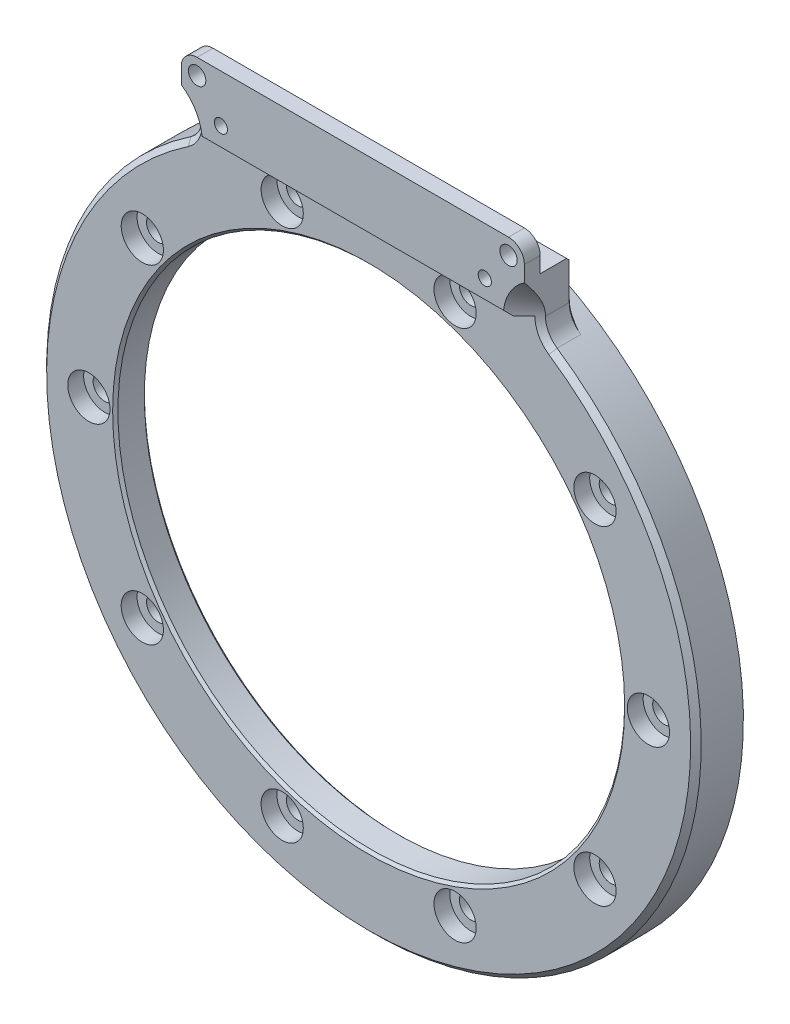
from build123d import *

# Parameters (mm, degrees)
SKETCH_1_R             = 62
SKETCH_1_R_2           = 60
EXTRUDE_1_DEPTH        = 3
EXTRUDE_START          = 6
SKETCH_2_R             = 48
EXTRUDE_2_DEPTH        = 6
FILLET_1_R             = 5
CHAMFER_1_SIZE         = 0.5
CHAMFER_2_SIZE         = 0.5
SKETCH_6_R             = 2.2
CUT_EXTRUDE_1_DEPTH    = 6
SKETCH_7_W             = 65
SKETCH_7_H             = 13.477482046
EXTRUDE_3_DEPTH        = 3
SKETCH_11_R            = 1.65
CUT_EXTRUDE_2_DEPTH    = 3
CHAMFER_3_SIZE         = 1
CHAMFER_4_SIZE         = 1
FILLET_2_R             = 3
CHAMFER_5_3_ANGLE      = 291.929687
SKETCH_12_R            = 4
CUT_EXTRUDE_3_DEPTH    = 3
CUT_EXTRUDE_4_DEPTH    = 2
CHAMFER_6_SIZE         = 1
HOLE_WIZARD_M3_1_D     = 2.5
HOLE_WIZARD_M3_1_DEPTH = 7.5
HOLE_WIZARD_M3_1_TIP   = 0.751075774


with BuildPart() as part:
    # 草图1 → 凸台-拉伸1 (new body)
    with BuildSketch(Plane.XY):
        Circle(SKETCH_1_R)
        Circle(SKETCH_1_R_2, mode=Mode.SUBTRACT)
    extrude(amount=-EXTRUDE_1_DEPTH)

    # 草图2 → 凸台-拉伸2 (add)
    with BuildSketch(Plane.XY.offset(EXTRUDE_START)):
        with BuildLine():
            Line((-32.5, 63), (32.5, 63))
            Line((32.5, 63), (32.5, 52.79914772))
            ThreePointArc((32.5, 52.79914772), (0, -62), (-32.5, 52.79914772))
            Line((-32.5, 52.79914772), (-32.5, 63))
        make_face()
        Circle(SKETCH_2_R, mode=Mode.SUBTRACT)
    extrude(amount=-EXTRUDE_2_DEPTH)

    # 圆角1
    # the kernel refuses this fillet: 5 mm, written as the material it adds along each edge
    with BuildSketch(Plane(origin=(32.5, 52.79914772, 6), x_dir=(0.8403342947446245, -0.5420685132675156, 0), z_dir=(0, 0, -1))) as fillet_1_piece_1:
        with BuildLine():
            CenterArc((2.72541822, -4.998883971), FILLET_1_R, 91.210593649, 55.964843523)
            Line((-1.476253254, -2.288541405), (0, 0))
            ThreePointArc((0, 0), (1.309890927, -0.013838756), (2.619781855, 0))
        make_face()
    extrude(amount=6)
    with BuildSketch(Plane(origin=(-32.5, 52.79914772, 6), x_dir=(-0.840334294744627, -0.5420685132675117, 0), z_dir=(0, 0, -1))) as fillet_1_piece_2:
        with BuildLine():
            CenterArc((2.72541822, 4.998883971), FILLET_1_R, 212.824562828, 55.964843523)
            Line((-1.476253254, 2.288541405), (0, 0))
            ThreePointArc((0, 0), (1.309890927, 0.013838756), (2.619781855, 0))
        make_face()
    extrude(amount=6)

    # 倒角1
    chamfer_1_edges = [part.edges().sort_by_distance(p)[0] for p in [
        (-48, 0, 0),
        (-48, 0, 6),
        (-60, 0, -3),
    ]]
    chamfer(chamfer_1_edges, length=CHAMFER_1_SIZE)

    # 倒角2
    # the kernel refuses this chamfer: 0.5 mm, written as the material it takes off along each edge
    with BuildSketch(Plane(origin=(-32.5, 55.522517954, 0), x_dir=(0, 0, 1), z_dir=(0, 1, 0)), Plane(origin=(32.5, 64.285841494, 0), x_dir=(0, 0, 1), z_dir=(0, -1, 0))) as chamfer_2_piece_1:
        Polygon((CHAMFER_2_SIZE, 0), (0, CHAMFER_2_SIZE), (0, 0), align=None)
    extrude(amount=8.76332354, mode=Mode.SUBTRACT)
    with BuildSketch(Plane(origin=(37.5, 55.522517954, 0), x_dir=(-0.15613015555825177, -0.9877364904291813, 0), z_dir=(0.9877364904291813, -0.15613015555825177, 0))) as chamfer_2_piece_2_section:
        Polygon((5, -CHAMFER_2_SIZE), (5 + CHAMFER_2_SIZE, 0), (5, 0), align=None)
    chamfer_2_piece_2 = revolve(axis=Axis((37.5, 55.522517954, 0), (0, 0, -1)), revolution_arc=81.017652556, mode=Mode.PRIVATE)
    chamfer_2_piece_2 = chamfer_2_piece_2 - Plane(origin=(0, 0, 0), x_dir=(1, 0, 0), z_dir=(0, 0, 1)) * Cylinder(62, 22, mode=Mode.PRIVATE)
    add(chamfer_2_piece_2, mode=Mode.SUBTRACT)
    with BuildSketch(Plane(origin=(-37.5, 55.522517954, 0), x_dir=(1, 0, 0), z_dir=(0, 1, 0))) as chamfer_2_piece_3_section:
        Polygon((5, -CHAMFER_2_SIZE), (5 + CHAMFER_2_SIZE, 0), (5, 0), align=None)
    chamfer_2_piece_3 = revolve(axis=Axis((-37.5, 55.522517954, 0), (0, 0, -1)), revolution_arc=81.017652556, mode=Mode.PRIVATE)
    chamfer_2_piece_3 = chamfer_2_piece_3 - Plane(origin=(0, 0, 0), x_dir=(1, 0, 0), z_dir=(0, 0, 1)) * Cylinder(62, 22, mode=Mode.PRIVATE)
    add(chamfer_2_piece_3, mode=Mode.SUBTRACT)

    # 草图6 → 切除-拉伸1 (cut)
    with BuildSketch(Plane(origin=(0, 0, 0), x_dir=(-1, 0, 0), z_dir=(0, 0, -1))):
        with Locations((-42.877900702, 31.152618372)):
            Circle(SKETCH_6_R)
        with Locations((-53, 0)):
            Circle(SKETCH_6_R)
        with Locations((-42.877900702, -31.152618371)):
            Circle(SKETCH_6_R)
        with Locations((-16.377900702, -50.405995364)):
            Circle(SKETCH_6_R)
        with Locations((16.377900702, -50.405995364)):
            Circle(SKETCH_6_R)
        with Locations((42.877900702, -31.152618371)):
            Circle(SKETCH_6_R)
        with Locations((53, 0)):
            Circle(SKETCH_6_R)
        with Locations((42.877900702, 31.152618372)):
            Circle(SKETCH_6_R)
        with Locations((16.377900702, 50.405995364)):
            Circle(SKETCH_6_R)
        with Locations((-16.377900702, 50.405995364)):
            Circle(SKETCH_6_R)
    extrude(amount=-CUT_EXTRUDE_1_DEPTH, mode=Mode.SUBTRACT)

    # 草图7 → 凸台-拉伸3 (add)
    with BuildSketch(Plane.XY.offset(6)):
        with Locations((0, 62.261258977)):
            Rectangle(SKETCH_7_W, SKETCH_7_H)
    extrude(amount=EXTRUDE_3_DEPTH)

    # 草图11 → 切除-拉伸2 (cut)
    with BuildSketch(Plane.XY.offset(9)):
        with Locations((-29.5, 66)):
            Circle(SKETCH_11_R)
        with Locations((29.5, 66)):
            Circle(SKETCH_11_R)
    extrude(amount=-CUT_EXTRUDE_2_DEPTH, mode=Mode.SUBTRACT)

    # 倒角3
    chamfer_3_edges = [part.edges().sort_by_distance(p)[0] for p in [
        (0, 63, 0),
    ]]
    chamfer(chamfer_3_edges, length=CHAMFER_3_SIZE - 0.0001)  # a hair under: the kernel refuses the full size

    # 倒角4
    chamfer_4_edges = [part.edges().sort_by_distance(p)[0] for p in [
        (0, 55.522517954, 9),
    ]]
    chamfer(chamfer_4_edges, length=CHAMFER_4_SIZE)

    # 圆角2
    fillet_2_edges = [part.edges().sort_by_distance(p)[0] for p in [
        (-32.5, 69, 7.5),
        (32.5, 69, 7.5),
    ]]
    fillet(fillet_2_edges, radius=FILLET_2_R)

    # 倒角5: read off the stored shape, not the designer's step
    # 倒角5 outline → 倒角5 (revolve, cut)
    with BuildSketch(Plane(origin=(37.5, 55.522517954, 0), x_dir=(1, 0, 0), z_dir=(0, -1, 0))):
        Polygon((4.999998721, 9), (4.999998721, 4.999998721), (9, 9), align=None)
    revolve(axis=Axis((37.5, 55.522517954, 0), (0, 0, 1)), mode=Mode.SUBTRACT)

    # Chamfer 5 2 outline → Chamfer 5 2 (revolve, cut)
    with BuildSketch(Plane(origin=(-37.5, 55.522517954, 0), x_dir=(1, 0, 0), z_dir=(0, -1, 0))):
        Polygon((4.99999762, 9), (4.99999762, 4.99999762), (9, 9), align=None)
    revolve(axis=Axis((-37.5, 55.522517954, 0), (0, 0, 1)), mode=Mode.SUBTRACT)

    # Chamfer 5 3 outline → Chamfer 5 3 (revolve, cut)
    with BuildSketch(Plane(origin=(0, 0, 0), x_dir=(-0.5597014925373135, 0.8286942978273132, 0), z_dir=(0.8286942978273132, 0.5597014925373135, 0))):
        Polygon((62, 6), (61, 6), (62, 5), align=None)
    revolve(axis=Axis((0, 0, 0), (0, 0, 1)), revolution_arc=CHAMFER_5_3_ANGLE, mode=Mode.SUBTRACT)

    # 草图12 → 切除-拉伸3 (cut)
    with BuildSketch(Plane.XY.offset(6)):
        with Locations((-16.377900702, 50.405995364)):
            Circle(SKETCH_12_R)
        with Locations((16.377900702, 50.405995364)):
            Circle(SKETCH_12_R)
        with Locations((42.877900702, 31.152618372)):
            Circle(SKETCH_12_R)
        with Locations((53, 0)):
            Circle(SKETCH_12_R)
        with Locations((42.877900702, -31.152618371)):
            Circle(SKETCH_12_R)
        with Locations((16.377900702, -50.405995364)):
            Circle(SKETCH_12_R)
        with Locations((-16.377900702, -50.405995364)):
            Circle(SKETCH_12_R)
        with Locations((-42.877900702, -31.152618371)):
            Circle(SKETCH_12_R)
        with Locations((-53, 0)):
            Circle(SKETCH_12_R)
        with Locations((-42.877900702, 31.152618372)):
            Circle(SKETCH_12_R)
    extrude(amount=-CUT_EXTRUDE_3_DEPTH, mode=Mode.SUBTRACT)

    # 草图14 → 切除-拉伸4 (cut)
    with BuildSketch(Plane(origin=(0, 63, 0), x_dir=(1, 0, 0), z_dir=(0, 1, 0))):
        with BuildLine():
            ThreePointArc((-4.030108666, 3.809429698), (-11.733833556, 7.447967709), (-11.5, -1.068584287))
            ThreePointArc((-11.5, -1.068584287), (0, -4.15), (11.5, -1.068584287))
            ThreePointArc((11.5, -1.068584287), (11.733833556, 7.447967709), (4.030108666, 3.809429698))
            ThreePointArc((4.030108666, 3.809429698), (0, 5.85), (-4.030108666, 3.809429698))
        make_face()
    extrude(amount=-CUT_EXTRUDE_4_DEPTH, mode=Mode.SUBTRACT)

    # 倒角6
    # the kernel refuses this chamfer: 1 mm, written as the material it takes off along each edge
    with BuildSketch(Plane(origin=(18.80558547, 61, -3), x_dir=(0, -1, 0), z_dir=(-1, 0, 0))) as chamfer_6_piece_1:
        Polygon((CHAMFER_6_SIZE, 0), (0, CHAMFER_6_SIZE), (0, 0), align=None)
    extrude(amount=37.61117094, mode=Mode.SUBTRACT)
    with BuildSketch(Plane(origin=(-9, 63, -3.261542732), x_dir=(-0.874686173337968, 0, 0.48468969266055384), z_dir=(-0.48468969266055384, 0, -0.874686173337968))) as chamfer_6_piece_2:
        Polygon((5, -CHAMFER_6_SIZE), (5 + CHAMFER_6_SIZE, 0), (5, 0), align=None)
    revolve(axis=Axis((-9, 63, -3.261542732), (0, 1, 0)), revolution_arc=31.007856081, mode=Mode.SUBTRACT)
    with BuildSketch(Plane(origin=(9, 63, -3.261542732), x_dir=(0.49999999999998873, 0, 0.8660254037844451), z_dir=(-0.8660254037844451, 0, 0.49999999999998873))) as chamfer_6_piece_3:
        Polygon((5, -CHAMFER_6_SIZE), (5 + CHAMFER_6_SIZE, 0), (5, 0), align=None)
    revolve(axis=Axis((9, 63, -3.261542732), (0, 1, 0)), revolution_arc=31.007856081, mode=Mode.SUBTRACT)
    with BuildSketch(Plane(origin=(0, 63, -18.85), x_dir=(-0.500000000000001, 0, 0.8660254037844382), z_dir=(-0.8660254037844382, 0, -0.500000000000001))) as chamfer_6_piece_4:
        Polygon((23, -CHAMFER_6_SIZE), (23 + CHAMFER_6_SIZE, 0), (23, 0), align=None)
    revolve(axis=Axis((0, 63, -18.85), (0, 1, 0)), revolution_arc=60, mode=Mode.SUBTRACT)

    # M3 螺纹孔1
    with Locations(Plane.XY.offset(9)):
        with Locations((-25, 60), (25, 60)):
            Hole(HOLE_WIZARD_M3_1_D / 2, depth=HOLE_WIZARD_M3_1_DEPTH)
            with Locations((0, 0, -(HOLE_WIZARD_M3_1_DEPTH + HOLE_WIZARD_M3_1_TIP / 2))):  # 118° drill point
                Cone(0, HOLE_WIZARD_M3_1_D / 2, HOLE_WIZARD_M3_1_TIP, mode=Mode.SUBTRACT)


solid = part.part
